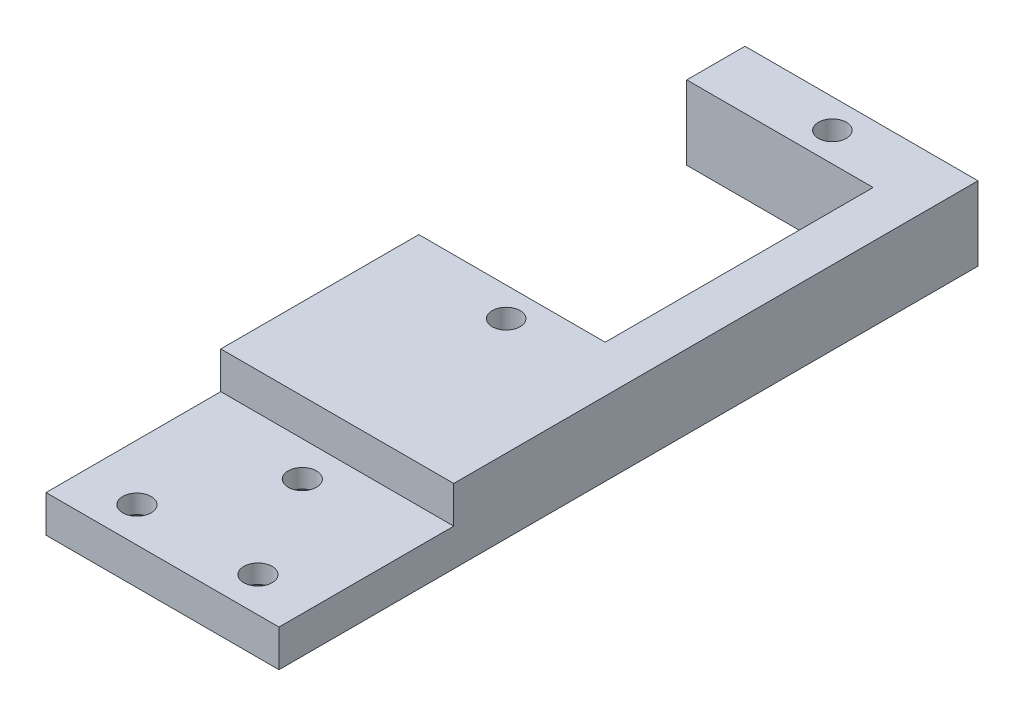
from build123d import *

# Parameters (mm, degrees)
SKETCH2_W                      = 20
SKETCH2_H                      = 60
BOSS_EXTRUDE1_DEPTH            = 6.35
SKETCH4_W                      = 16
SKETCH4_H                      = 23
CUT_EXTRUDE1_DEPTH             = 64.563531211
M2_CLEARANCE_HOLE1_D           = 2.4
SKETCH10_W                     = 15
SKETCH10_H                     = 3.175
CUT_EXTRUDE2_DEPTH             = 64.563531211
F_2_CLEARANCE_HOLE1_AT_2_COUNT = 2
F_2_CLEARANCE_HOLE1_AT_2_PITCH = 10.392304845
F_2_CLEARANCE_HOLE1_AT_3_COUNT = 2
F_2_CLEARANCE_HOLE1_AT_3_PITCH = 10.392304845


with BuildPart() as part:
    # Sketch2 → Boss-Extrude1 (new body)
    with BuildSketch(Plane(origin=(0, 0, 0), x_dir=(1, 0, 0), z_dir=(0, 1, 0))):
        with Locations((10, -30)):
            Rectangle(SKETCH2_W, SKETCH2_H)
    extrude(amount=BOSS_EXTRUDE1_DEPTH)

    # Sketch4 → Cut-Extrude1 (cut, through all)
    with BuildSketch(Plane(origin=(0, 6.35, 0), x_dir=(1, 0, 0), z_dir=(0, 1, 0))):
        with Locations((8, -16.5)):
            Rectangle(SKETCH4_W, SKETCH4_H)
    extrude(amount=-CUT_EXTRUDE1_DEPTH, mode=Mode.SUBTRACT)

    # M2 Clearance Hole1 (through all)
    with Locations(Plane(origin=(0, 6.35, 0), x_dir=(1, 0, 0), z_dir=(0, 1, 0))):
        with Locations((10, -30.5), (10, -2.5)):
            Hole(M2_CLEARANCE_HOLE1_D / 2)

    # Sketch10 → Cut-Extrude2 (cut, through all)
    with BuildSketch(Plane(origin=(20, 0, 0), x_dir=(0, 0, -1), z_dir=(1, 0, 0))):
        with Locations((-52.5, 4.7625)):
            Rectangle(SKETCH10_W, SKETCH10_H)
    extrude(amount=-CUT_EXTRUDE2_DEPTH, mode=Mode.SUBTRACT)

    # Sketch14 → #2 Clearance Hole1 (revolve, cut)
    with BuildSketch(Plane(origin=(10, 3.175, 48), x_dir=(0, 0, 1), z_dir=(1, 0, 0))):
        Polygon((0, 0), (0, 3.175), (2.54, 3.175), (1.2192, 1.600931855), (1.2192, 0), align=None)
    f_2_clearance_hole1 = revolve(axis=Axis((10, 9.525, 48), (0, -1, 0)), mode=Mode.SUBTRACT)

    # #2 Clearance Hole1 at 2: #2 Clearance Hole1 ×2
    with Locations(*[Vector(-0.49999999999999994, 0, 0.8660254037844387) * (i * F_2_CLEARANCE_HOLE1_AT_2_PITCH) for i in range(1, F_2_CLEARANCE_HOLE1_AT_2_COUNT)]):
        add(f_2_clearance_hole1, mode=Mode.SUBTRACT)

    # #2 Clearance Hole1 at 3: #2 Clearance Hole1 ×2
    with Locations(*[Vector(0.4999999999999999, 0, 0.8660254037844388) * (i * F_2_CLEARANCE_HOLE1_AT_3_PITCH) for i in range(1, F_2_CLEARANCE_HOLE1_AT_3_COUNT)]):
        add(f_2_clearance_hole1, mode=Mode.SUBTRACT)


solid = part.part
